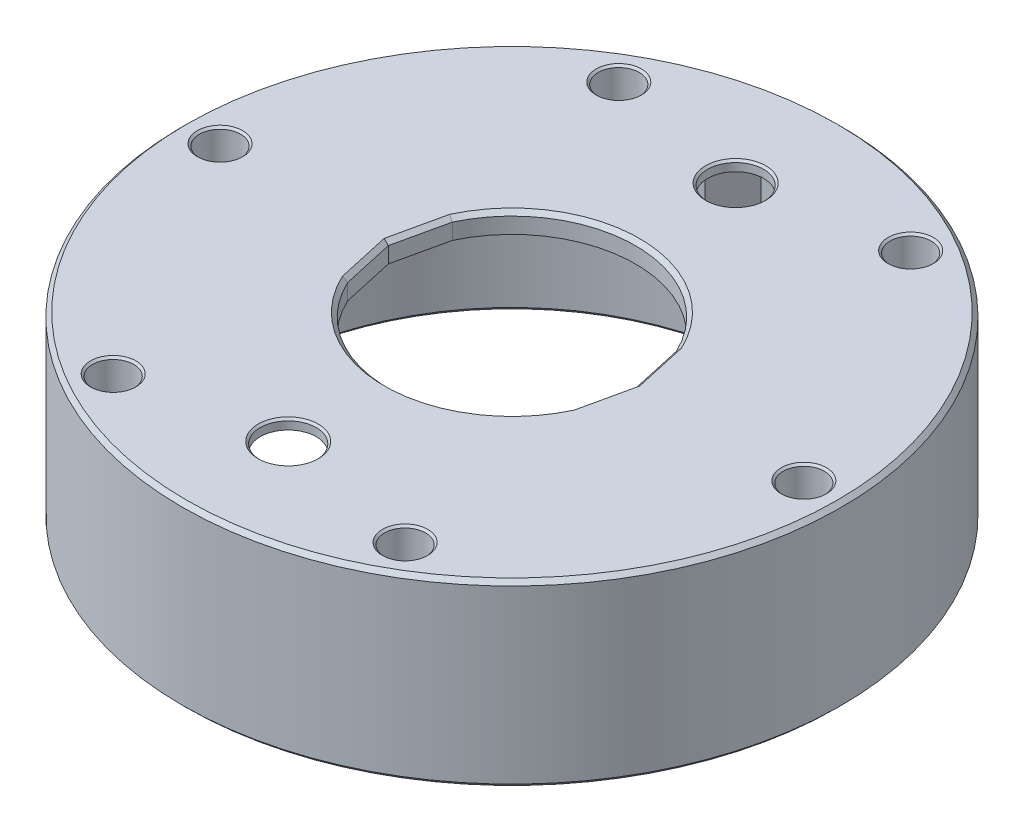
from build123d import *

# Parameters (mm, degrees)
SKETCH1_R           = 16.5
SKETCH1_R_2         = 12.73
BOSS_EXTRUDE1_DEPTH = 8
SKETCH2_R           = 16.5
BOSS_EXTRUDE2_DEPTH = 1
SKETCH3_R           = 1.4025
CUT_EXTRUDE1_DEPTH  = 12
CUT_EXTRUDE2_DEPTH  = 12
CUT_EXTRUDE3_DEPTH  = 0.5
CUT_EXTRUDE4_DEPTH  = 17.5
CUT_EXTRUDE5_DEPTH  = 0.5
SCALE1_SCALE        = 1.212121212
CHAMFER1_SIZE       = 0.25
CHAMFER2_SIZE       = 0.125
CHAMFER3_SIZE       = 0.25
CHAMFER4_SIZE       = 0.25
SKETCH8_R           = 1.25
CUT_EXTRUDE6_DEPTH  = 31.315342037
CHAMFER5_SIZE       = 0.125


with BuildPart() as part:
    # Sketch1 → Boss-Extrude1 (new body)
    with BuildSketch(Plane(origin=(0, 0, 0), x_dir=(1, 0, 0), z_dir=(0, 1, 0))):
        Circle(SKETCH1_R)
        Circle(SKETCH1_R_2, mode=Mode.SUBTRACT)
    extrude(amount=BOSS_EXTRUDE1_DEPTH)

    # Sketch2 → Boss-Extrude2 (add)
    with BuildSketch(Plane(origin=(0, 8, 0), x_dir=(1, 0, 0), z_dir=(0, 1, 0))):
        Circle(SKETCH2_R)
    extrude(amount=BOSS_EXTRUDE2_DEPTH)

    # Sketch3 → Cut-Extrude1 (cut)
    with BuildSketch(Plane(origin=(0, 9, 0), x_dir=(1, 0, 0), z_dir=(0, 1, 0))):
        with Locations((0, 11.2)):
            Circle(SKETCH3_R)
        with BuildLine():
            ThreePointArc((5.605680559, 2.619446836), (0, 6.1875), (-5.605680559, 2.619446836))
            Line((-5.605680559, 2.619446836), (-6.1875, 0))
            Line((-6.1875, 0), (-5.605680559, -2.619446836))
            ThreePointArc((-5.605680559, -2.619446836), (0, -6.1875), (5.605680559, -2.619446836))
            Line((5.605680559, -2.619446836), (6.1875, 0))
            Line((6.1875, 0), (5.605680559, 2.619446836))
        make_face()
        with Locations((0, -11.2)):
            Circle(SKETCH3_R)
    extrude(amount=-CUT_EXTRUDE1_DEPTH, mode=Mode.SUBTRACT)

    # Sketch4 → Cut-Extrude2 (cut)
    with BuildSketch(Plane.XZ.offset(-8)):
        Polygon((3.464101615, 11.2), (1.732050808, 14.2), (-1.732050808, 14.2), (-3.464101615, 11.2), (-1.732050808, 8.2), (1.732050808, 8.2), align=None)
    extrude(amount=CUT_EXTRUDE2_DEPTH, mode=Mode.SUBTRACT)

    # Sketch5 → Cut-Extrude3 (cut)
    with BuildSketch(Plane.XZ.offset(-8)):
        Polygon((3.441649055, 11.2), (1.720824528, 14.180555513), (-1.720824528, 14.180555513), (-3.441649055, 11.2), (-1.720824528, 8.219444487), (1.720824528, 8.219444487), align=None)
    extrude(amount=-CUT_EXTRUDE3_DEPTH, mode=Mode.SUBTRACT)

    # Sketch6 → Cut-Extrude4 (cut)
    with BuildSketch(Plane.XZ.offset(-8)):
        Polygon((3.464101615, -11.2), (1.732050808, -8.2), (-1.732050808, -8.2), (-3.464101615, -11.2), (-1.732050808, -14.2), (1.732050808, -14.2), align=None)
    extrude(amount=CUT_EXTRUDE4_DEPTH, mode=Mode.SUBTRACT)

    # Sketch7 → Cut-Extrude5 (cut)
    with BuildSketch(Plane.XZ.offset(-8)):
        Polygon((3.487584053, -11.2), (1.743792026, -8.179663613), (-1.743792026, -8.179663613), (-3.487584053, -11.2), (-1.743792026, -14.220336387), (1.743792026, -14.220336387), align=None)
    extrude(amount=-CUT_EXTRUDE5_DEPTH, mode=Mode.SUBTRACT)


with BuildPart() as part_1:
    # Scale1: scaled about (0, 4.937956198, 0.001378728)
    add(part.part.scale(SCALE1_SCALE).moved(Location((0, -1.047445254, -0.000292457))))

    # Chamfer1
    chamfer1_edges = [part_1.edges().sort_by_distance(p)[0] for p in [
        (-7.147382157, 9.861645655, 1.587251079),
        (-7.147382157, 9.861645655, -1.587835994),
        (0, 9.861645655, -7.500292457),
        (7.147382157, 9.861645655, -1.587835994),
        (7.147382157, 9.861645655, 1.587251079),
        (0, 9.861645655, 7.499707543),
        (-20, 9.861645655, -0.000292457),
    ]]
    chamfer(chamfer1_edges, length=CHAMFER1_SIZE)

    # Chamfer2
    chamfer2_edges = [part_1.edges().sort_by_distance(p)[0] for p in [
        (-1.7, 9.861645655, -13.576050033),
        (-1.7, 9.861645655, 13.575465118),
    ]]
    chamfer(chamfer2_edges, length=CHAMFER2_SIZE)

    # Chamfer3
    chamfer3_edges = [part_1.edges().sort_by_distance(p)[0] for p in [
        (2.719380836, -1.047445254, -16.138671532),
        (0, -1.047445254, -17.21241367),
        (-2.719380836, -1.047445254, -16.138671532),
        (-15.43030303, -1.047445254, -0.000292457),
        (-2.719380836, -1.047445254, 16.138086617),
        (0, -1.047445254, 17.211828755),
        (2.719380836, -1.047445254, 16.138086617),
        (15.43030303, -1.047445254, -0.000292457),
    ]]
    chamfer(chamfer3_edges, length=CHAMFER3_SIZE)

    # Chamfer4
    chamfer4_edges = [part_1.edges().sort_by_distance(p)[0] for p in [
        (-20, -1.047445254, -0.000292457),
    ]]
    chamfer(chamfer4_edges, length=CHAMFER4_SIZE)

    # Sketch8 → Cut-Extrude6 (cut, through all)
    with BuildSketch(Plane(origin=(0, 9.861645655, 0), x_dir=(1, 0, 0), z_dir=(0, 1, 0))):
        with Locations((-17.7143, 0)):
            Circle(SKETCH8_R)
        with Locations((17.7143, 0)):
            Circle(SKETCH8_R)
        with Locations((-8.85715, -15.34103381)):
            Circle(SKETCH8_R)
        with Locations((8.85715, 15.34103381)):
            Circle(SKETCH8_R)
        with Locations((-8.85715, 15.34103381)):
            Circle(SKETCH8_R)
        with Locations((8.85715, -15.34103381)):
            Circle(SKETCH8_R)
    extrude(amount=-CUT_EXTRUDE6_DEPTH, mode=Mode.SUBTRACT)

    # Chamfer5
    chamfer5_edges = [part_1.edges().sort_by_distance(p)[0] for p in [
        (7.60715, 9.861645655, -15.34103381),
        (16.4643, 9.861645655, 0),
        (7.60715, 9.861645655, 15.34103381),
        (-10.10715, 9.861645655, 15.34103381),
        (-10.10715, 9.861645655, -15.34103381),
        (-18.9643, 9.861645655, 0),
    ]]
    chamfer(chamfer5_edges, length=CHAMFER5_SIZE)


solid = part_1.part
